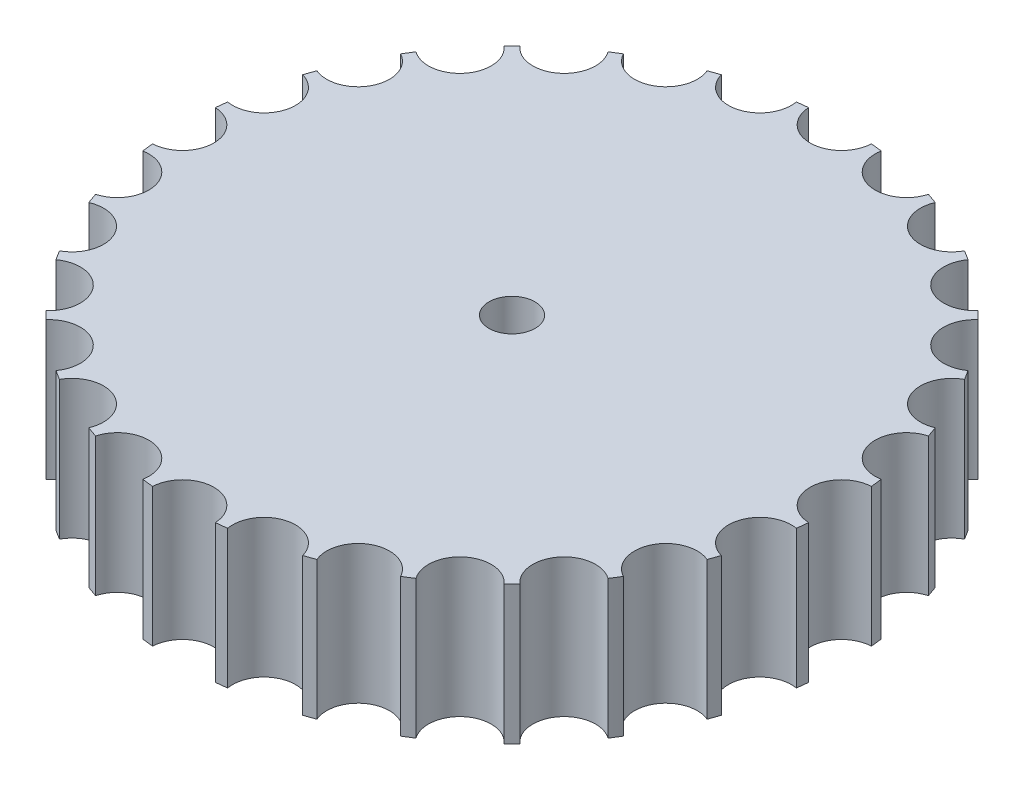
from build123d import *

# Parameters (mm, degrees)
SKETCH1_R           = 2.5
BOSS_EXTRUDE1_DEPTH = 15


with BuildPart() as part:
    # Sketch1 → Boss-Extrude1 (new body)
    with BuildSketch(Plane(origin=(0, 0, 0), x_dir=(1, 0, 0), z_dir=(0, 1, 0))):
        with BuildLine():
            ThreePointArc((3.4, 35.563460403), (0, 32.321752397), (-3.4, 35.563460403))
            ThreePointArc((-3.4, 35.563460403), (-4, 35.5009819), (-4.598859522, 35.428381376))
            ThreePointArc((-4.598859522, 35.428381376), (-7.192266531, 31.511378583), (-11.228369325, 33.915239025))
            ThreePointArc((-11.228369325, 33.915239025), (-11.799423297, 33.720814428), (-12.367113025, 33.516775371))
            ThreePointArc((-12.367113025, 33.516775371), (-14.023882785, 29.120892666), (-18.493701327, 30.566365945))
            ThreePointArc((-18.493701327, 30.566365945), (-19.007174241, 30.249744515), (-19.51522784, 29.924498295))
            ThreePointArc((-19.51522784, 29.924498295), (-20.152282998, 25.270163593), (-24.831681921, 25.684767642))
            ThreePointArc((-24.831681921, 25.684767642), (-25.2618261, 25.2618261), (-25.684767642, 24.831681921))
            ThreePointArc((-25.684767642, 24.831681921), (-25.270163593, 20.152282998), (-29.924498295, 19.51522784))
            ThreePointArc((-29.924498295, 19.51522784), (-30.249744515, 19.007174241), (-30.566365945, 18.493701327))
            ThreePointArc((-30.566365945, 18.493701327), (-29.120892666, 14.023882785), (-33.516775371, 12.367113025))
            ThreePointArc((-33.516775371, 12.367113025), (-33.720814428, 11.799423297), (-33.915239025, 11.228369325))
            ThreePointArc((-33.915239025, 11.228369325), (-31.511378583, 7.192266531), (-35.428381376, 4.598859522))
            ThreePointArc((-35.428381376, 4.598859522), (-35.5009819, 4), (-35.563460403, 3.4))
            ThreePointArc((-35.563460403, 3.4), (-32.321752397, 0), (-35.563460403, -3.4))
            ThreePointArc((-35.563460403, -3.4), (-35.5009819, -4), (-35.428381376, -4.598859522))
            ThreePointArc((-35.428381376, -4.598859522), (-31.511378583, -7.192266531), (-33.915239025, -11.228369325))
            ThreePointArc((-33.915239025, -11.228369325), (-33.720814428, -11.799423297), (-33.516775371, -12.367113025))
            ThreePointArc((-33.516775371, -12.367113025), (-29.120892666, -14.023882785), (-30.566365945, -18.493701327))
            ThreePointArc((-30.566365945, -18.493701327), (-30.249744515, -19.007174241), (-29.924498295, -19.51522784))
            ThreePointArc((-29.924498295, -19.51522784), (-25.270163593, -20.152282998), (-25.684767642, -24.831681921))
            ThreePointArc((-25.684767642, -24.831681921), (-25.2618261, -25.2618261), (-24.831681921, -25.684767642))
            ThreePointArc((-24.831681921, -25.684767642), (-20.152282998, -25.270163593), (-19.51522784, -29.924498295))
            ThreePointArc((-19.51522784, -29.924498295), (-19.007174241, -30.249744515), (-18.493701327, -30.566365945))
            ThreePointArc((-18.493701327, -30.566365945), (-14.023882785, -29.120892666), (-12.367113025, -33.516775371))
            ThreePointArc((-12.367113025, -33.516775371), (-11.799423297, -33.720814428), (-11.228369325, -33.915239025))
            ThreePointArc((-11.228369325, -33.915239025), (-7.192266531, -31.511378583), (-4.598859522, -35.428381376))
            ThreePointArc((-4.598859522, -35.428381376), (-4, -35.5009819), (-3.4, -35.563460403))
            ThreePointArc((-3.4, -35.563460403), (0, -32.321752397), (3.4, -35.563460403))
            ThreePointArc((3.4, -35.563460403), (4, -35.5009819), (4.598859522, -35.428381376))
            ThreePointArc((4.598859522, -35.428381376), (7.192266531, -31.511378583), (11.228369325, -33.915239025))
            ThreePointArc((11.228369325, -33.915239025), (11.799423297, -33.720814428), (12.367113025, -33.516775371))
            ThreePointArc((12.367113025, -33.516775371), (14.023882785, -29.120892666), (18.493701327, -30.566365945))
            ThreePointArc((18.493701327, -30.566365945), (19.007174241, -30.249744515), (19.51522784, -29.924498295))
            ThreePointArc((19.51522784, -29.924498295), (20.152282998, -25.270163593), (24.831681921, -25.684767642))
            ThreePointArc((24.831681921, -25.684767642), (25.2618261, -25.2618261), (25.684767642, -24.831681921))
            ThreePointArc((25.684767642, -24.831681921), (25.270163593, -20.152282998), (29.924498295, -19.51522784))
            ThreePointArc((29.924498295, -19.51522784), (30.249744515, -19.007174241), (30.566365945, -18.493701327))
            ThreePointArc((30.566365945, -18.493701327), (29.120892666, -14.023882785), (33.516775371, -12.367113025))
            ThreePointArc((33.516775371, -12.367113025), (33.720814428, -11.799423297), (33.915239025, -11.228369325))
            ThreePointArc((33.915239025, -11.228369325), (31.511378583, -7.192266531), (35.428381376, -4.598859522))
            ThreePointArc((35.428381376, -4.598859522), (35.5009819, -4), (35.563460403, -3.4))
            ThreePointArc((35.563460403, -3.4), (32.321752397, 0), (35.563460403, 3.4))
            ThreePointArc((35.563460403, 3.4), (35.5009819, 4), (35.428381376, 4.598859522))
            ThreePointArc((35.428381376, 4.598859522), (31.511378583, 7.192266531), (33.915239025, 11.228369325))
            ThreePointArc((33.915239025, 11.228369325), (33.720814428, 11.799423297), (33.516775371, 12.367113025))
            ThreePointArc((33.516775371, 12.367113025), (29.120892666, 14.023882785), (30.566365945, 18.493701327))
            ThreePointArc((30.566365945, 18.493701327), (30.249744515, 19.007174241), (29.924498295, 19.51522784))
            ThreePointArc((29.924498295, 19.51522784), (25.270163593, 20.152282998), (25.684767642, 24.831681921))
            ThreePointArc((25.684767642, 24.831681921), (25.2618261, 25.2618261), (24.831681921, 25.684767642))
            ThreePointArc((24.831681921, 25.684767642), (20.152282998, 25.270163593), (19.51522784, 29.924498295))
            ThreePointArc((19.51522784, 29.924498295), (19.007174241, 30.249744515), (18.493701327, 30.566365945))
            ThreePointArc((18.493701327, 30.566365945), (14.023882785, 29.120892666), (12.367113025, 33.516775371))
            ThreePointArc((12.367113025, 33.516775371), (11.799423297, 33.720814428), (11.228369325, 33.915239025))
            ThreePointArc((11.228369325, 33.915239025), (7.192266531, 31.511378583), (4.598859522, 35.428381376))
            ThreePointArc((4.598859522, 35.428381376), (4, 35.5009819), (3.4, 35.563460403))
        make_face()
        Circle(SKETCH1_R, mode=Mode.SUBTRACT)
    extrude(amount=BOSS_EXTRUDE1_DEPTH)


solid = part.part
